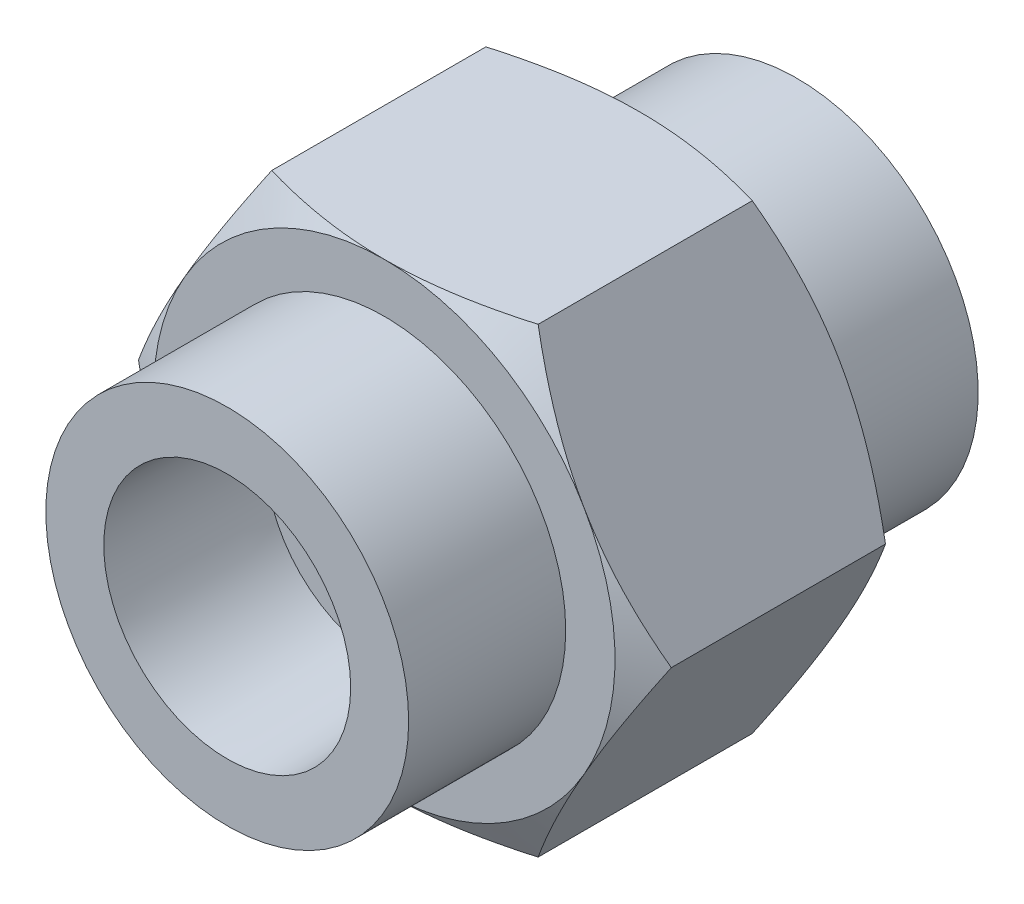
from build123d import *

# Parameters (mm, degrees)
BASE_DEPTH              = 24.60625
CUTSKETCH1_R            = 15.6765625
SIDECUT_DEPTH           = 13.57122
SKETCH4_R               = 10.668
CUT_EXTRUDE2_DEPTH      = 13.57122
CUT_EXTRUDE2_DRAFT      = -1.783333333
SKETCH5_R               = 7.540625
CUT_EXTRUDE3_DEPTH      = 24.60625
MIRROR1_COPY_1_SKETCH_R = 10.668
MIRROR1_COPY_1_DEPTH    = 13.57122
MIRROR1_COPY_1_DRAFT    = -1.783333333


# Read off the part's stored shape, not the designer's step: Chamfer1
with BuildPart() as part:
    # BaseSketch → Base (new, symmetric)
    with BuildSketch(Plane.XY):
        Polygon((-11.510366375, 19.936539375), (11.510366375, 19.936539375), (23.02073275, 0), (11.510366375, -19.936539375), (-11.510366375, -19.936539375), (-23.02073275, 0), align=None)
    extrude(amount=BASE_DEPTH, both=True)

    # CutSketch1 → SideCut (cut)
    with BuildSketch(Plane.XY.offset(24.60625)):
        Polygon((11.510366375, -19.936539375), (23.02073275, 0), (11.510366375, 19.936539375), (-11.510366375, 19.936539375), (-23.02073275, 0), (-11.510366375, -19.936539375), align=None)
        Circle(CUTSKETCH1_R, mode=Mode.SUBTRACT)
    sidecut = extrude(amount=-SIDECUT_DEPTH, mode=Mode.SUBTRACT)


with BuildPart() as cut_extrude2_tool:
    # Sketch4 → Cut-Extrude2 (with draft: the straight prism first)
    with BuildSketch(Plane(origin=(-0.730245843, 0.065793184, 24.60625), x_dir=(1, 0, 0), z_dir=(0, 0, 1))):
        with Locations((0.730245843, -0.065793184)):
            Circle(SKETCH4_R)
    extrude(amount=-CUT_EXTRUDE2_DEPTH)
    # Cut-Extrude2: the draft: its side faces are tilted about the plane it starts from
    cut_extrude2_sides = [cut_extrude2_tool.faces().sort_by_distance(p)[0] for p in [
        (-10.668, 0, 17.82064),
    ]]
    draft(cut_extrude2_sides, Plane(origin=(-0.730245843, 0.065793184, 24.60625), x_dir=(1, 0, 0), z_dir=(0, 0, 1)), CUT_EXTRUDE2_DRAFT)


with BuildPart() as part_1:
    add(part.part)

    # Cut-Extrude2: cut by cut_extrude2_tool
    add(cut_extrude2_tool.part, mode=Mode.SUBTRACT)

    # Sketch5 → Cut-Extrude3 (cut)
    with BuildSketch(Plane.XY.offset(24.60625)):
        Circle(SKETCH5_R)
    cut_extrude3 = extrude(amount=-CUT_EXTRUDE3_DEPTH, mode=Mode.SUBTRACT)

    # Cut-Extrude4 cone 1 section (through the dimple's axis) → Cut-Extrude4 (revolve, cut)
    with BuildSketch(Plane(origin=(0, 0, 0), x_dir=(0, -1, 0), z_dir=(1, 0, 0))):
        Polygon((0, 0), (7.540625, 0), (0, 4.353581874), align=None)
    revolve(axis=Axis((0, 0, 0), (0, 0, -1)), mode=Mode.SUBTRACT)

    # Chamfer1 outline → Chamfer1 (revolve, cut)
    with BuildSketch(Plane.XZ):
        Polygon((23.020732751, 11.03503009), (19.936539323, 11.03503009), (23.020732751, 9.254370124), align=None)
    chamfer1 = revolve(axis=Axis((0, 0, 0), (0, 0, 1)), mode=Mode.SUBTRACT)

    # Mirror1: SideCut, Cut-Extrude3, Chamfer1 across plane
    add(sidecut.mirror(Plane.XY), mode=Mode.SUBTRACT)
    add(cut_extrude3.mirror(Plane.XY), mode=Mode.SUBTRACT)
    add(chamfer1.mirror(Plane.XY), mode=Mode.SUBTRACT)


with BuildPart() as mirror1_copy_1_tool:
    # Mirror1 copy 1 sketch → Mirror1 copy 1 (with draft: the straight prism first)
    with BuildSketch(Plane(origin=(-0.730245843, 0.065793184, -24.60625), x_dir=(1, 0, 0), z_dir=(0, 0, -1))):
        with Locations((0.730245843, 0.065793184)):
            Circle(MIRROR1_COPY_1_SKETCH_R)
    extrude(amount=-MIRROR1_COPY_1_DEPTH)
    # Mirror1 copy 1: the draft: its side faces are tilted about the plane it starts from
    mirror1_copy_1_sides = [mirror1_copy_1_tool.faces().sort_by_distance(p)[0] for p in [
        (-10.668, 0, -17.82064),
    ]]
    draft(mirror1_copy_1_sides, Plane(origin=(-0.730245843, 0.065793184, -24.60625), x_dir=(1, 0, 0), z_dir=(0, 0, -1)), MIRROR1_COPY_1_DRAFT)


with BuildPart() as part_2:
    add(part_1.part)

    # Mirror1 copy 1: cut by mirror1_copy_1_tool
    add(mirror1_copy_1_tool.part, mode=Mode.SUBTRACT)


solid = part_2.part
